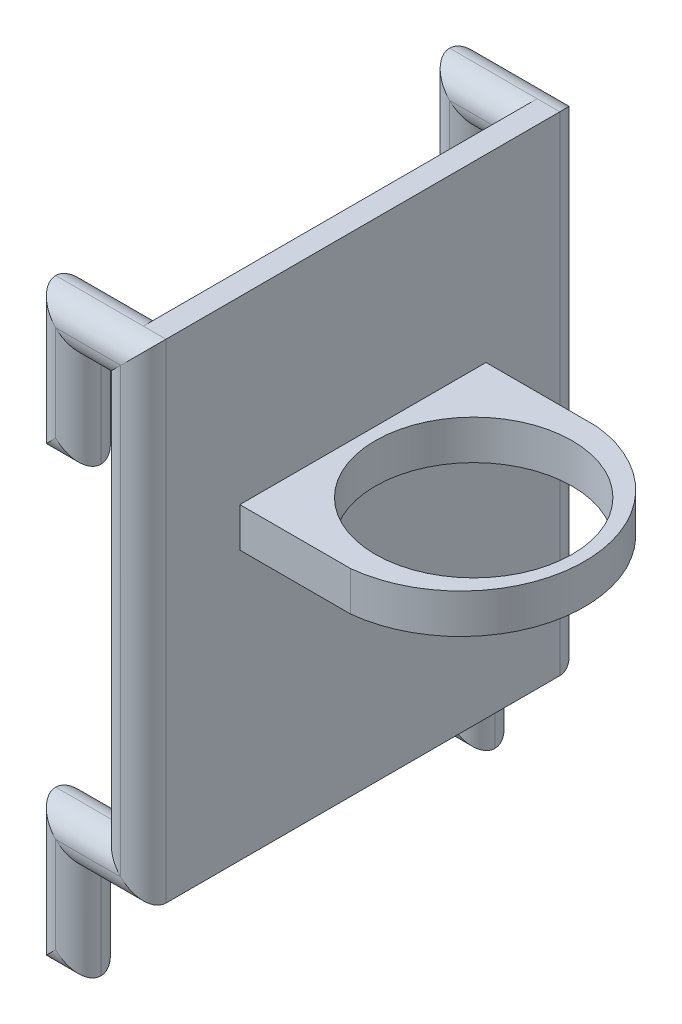
from build123d import *

# Parameters (mm, degrees)
EXTRU_MINCE1_DEPTH         = 2.3
CONG_1_R                   = 2.3
ESQUISSE2_W                = 40
ESQUISSE2_H                = 49.6
BOSS_EXTRU_1_DEPTH         = 2.3
R_P_TITION_LIN_AIRE1_COUNT = 2
R_P_TITION_LIN_AIRE1_PITCH = 40
CONG_2_R                   = 2.3
BOSS_EXTRU_2_START         = -20
ESQUISSE3_R                = 10
BOSS_EXTRU_2_DEPTH         = 4


with BuildPart() as part:
    # Esquisse1 → Extru.-Mince1 (new, symmetric)
    with BuildSketch(Plane.XY):
        Polygon((-4.3, -57), (-4.3, -47.3), (2.3, -47.3), (2.3, 2.3), (-8.9, 2.3), (-8.9, -12), (-4.3, -12), (-4.3, -2.3), (-2.3, -2.3), (-2.3, -42.7), (-8.9, -42.7), (-8.9, -57), align=None)
    extru_mince1 = extrude(amount=EXTRU_MINCE1_DEPTH, both=True)

    # Congé1
    cong_1_edges = [part.edges().sort_by_distance(p)[0] for p in [
        (-6.6, -57, -2.3),
        (-4.3, -52.15, -2.3),
        (-1, -47.3, -2.3),
        (2.3, -22.5, -2.3),
        (-3.3, 2.3, -2.3),
        (-8.9, -4.85, -2.3),
        (-6.6, -12, -2.3),
        (-4.3, -7.15, -2.3),
        (-3.3, -2.3, -2.3),
        (-2.3, -22.5, -2.3),
        (-5.6, -42.7, -2.3),
        (-8.9, -49.85, -2.3),
        (-5.6, -42.7, 2.3),
        (-2.3, -22.5, 2.3),
        (-3.3, -2.3, 2.3),
        (-4.3, -7.15, 2.3),
        (-6.6, -12, 2.3),
        (-8.9, -4.85, 2.3),
        (-3.3, 2.3, 2.3),
        (2.3, -22.5, 2.3),
        (-1, -47.3, 2.3),
        (-4.3, -52.15, 2.3),
        (-6.6, -57, 2.3),
        (-8.9, -49.85, 2.3),
    ]]
    fillet(cong_1_edges, radius=CONG_1_R - 0.0001)  # a hair under: the kernel refuses the full size

    # Esquisse2 → Boss.-Extru.1 (add)
    with BuildSketch(Plane(origin=(0, 0, 0), x_dir=(0, 0, -1), z_dir=(1, 0, 0))):
        with Locations((-20, -22.5)):
            Rectangle(ESQUISSE2_W, ESQUISSE2_H)
    extrude(amount=BOSS_EXTRU_1_DEPTH)

    # Répétition linéaire1: Extru.-Mince1 ×2
    with Locations(*[(0, 0, i * R_P_TITION_LIN_AIRE1_PITCH) for i in range(1, R_P_TITION_LIN_AIRE1_COUNT)]):
        add(extru_mince1)

    # Congé2
    cong_2_edges = [part.edges().sort_by_distance(p)[0] for p in [
        (-5.6, -42.7, 42.3),
        (-2.3, -22.5, 42.3),
        (-3.3, -2.3, 42.3),
        (-4.3, -7.15, 42.3),
        (-6.6, -12, 42.3),
        (-8.9, -4.85, 42.3),
        (-3.3, 2.3, 42.3),
        (2.3, -22.5, 42.3),
        (-6.6, -57, 42.3),
        (-4.3, -52.15, 42.3),
        (-1, -47.3, 42.3),
        (-8.9, -49.85, 42.3),
        (-2.15, -47.3, 37.7),
        (-4.3, -52.15, 37.7),
        (-6.6, -57, 37.7),
        (-8.9, -49.85, 37.7),
        (-5.6, -42.7, 37.7),
        (-2.3, -22.5, 37.7),
        (-3.3, -2.3, 37.7),
        (-4.3, -7.15, 37.7),
        (-6.6, -12, 37.7),
        (-8.9, -4.85, 37.7),
        (-4.45, 2.3, 37.7),
    ]]
    fillet(cong_2_edges, radius=CONG_2_R - 0.0001)  # a hair under: the kernel refuses the full size

    # Esquisse3 → Boss.-Extru.2 (add)
    with BuildSketch(Plane(origin=(0, 0, 0), x_dir=(1, 0, 0), z_dir=(0, 1, 0)).offset(BOSS_EXTRU_2_START)):
        with BuildLine():
            Line((2.3, -7.5), (13.55, -7.5))
            ThreePointArc((13.55, -7.5), (24.8, -20), (13.55, -32.5))
            Line((13.55, -32.5), (2.3, -32.5))
            Line((2.3, -32.5), (2.3, -7.5))
        make_face()
        with Locations(Location((13.55, -20, 0), (0, 0, 270))):
            Circle(ESQUISSE3_R, mode=Mode.SUBTRACT)
    extrude(amount=BOSS_EXTRU_2_DEPTH)


solid = part.part
